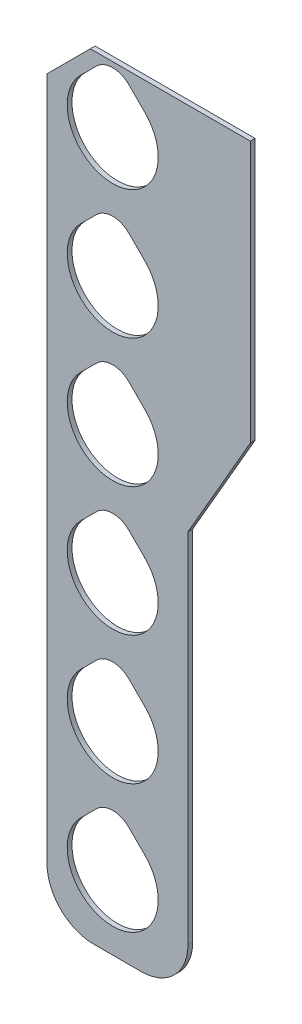
from build123d import *

# Parameters (mm, degrees)
EXTRUDE_1_DEPTH = 1


with BuildPart() as part:
    # 草图1 → 凸台-拉伸1 (new body)
    with BuildSketch(Plane.XY):
        with BuildLine():
            Line((15.8, 70.053589838), (28.876696831, 92.703093144))
            Line((28.876696831, 92.703093144), (28.876696831, 147.603847577))
            Line((28.876696831, 147.603847577), (-4.69377267, 147.603847577))
            Line((-4.69377267, 147.603847577), (-13.8, 138.497620247))
            Line((-13.8, 138.497620247), (-13.8, -5))
            ThreePointArc((-13.8, -5), (-10.929646456, -11.929646456), (-4, -14.8))
            Line((-4, -14.8), (6, -14.8))
            ThreePointArc((6, -14.8), (12.929646456, -11.929646456), (15.8, -5))
            Line((15.8, -5), (15.8, 70.053589838))
        make_face()
        with BuildLine():
            Line((-6.75286976, 6.75286976), (-3.411790219, 10.093949301))
            ThreePointArc((-3.411790219, 10.093949301), (0, 11.507159082), (3.411790219, 10.093949301))
            Line((3.411790219, 10.093949301), (6.75286976, 6.75286976))
            ThreePointArc((6.75286976, 6.75286976), (0, -9.55), (-6.75286976, 6.75286976))
        make_face(mode=Mode.SUBTRACT)
        with BuildLine():
            Line((3.411790219, 37.093949301), (6.75286976, 33.75286976))
            ThreePointArc((6.75286976, 33.75286976), (0, 17.45), (-6.75286976, 33.75286976))
            Line((-6.75286976, 33.75286976), (-3.411790219, 37.093949301))
            ThreePointArc((-3.411790219, 37.093949301), (0, 38.507159082), (3.411790219, 37.093949301))
        make_face(mode=Mode.SUBTRACT)
        with BuildLine():
            Line((3.411790219, 64.093949301), (6.75286976, 60.75286976))
            ThreePointArc((6.75286976, 60.75286976), (0, 44.45), (-6.75286976, 60.75286976))
            Line((-6.75286976, 60.75286976), (-3.411790219, 64.093949301))
            ThreePointArc((-3.411790219, 64.093949301), (0, 65.507159082), (3.411790219, 64.093949301))
        make_face(mode=Mode.SUBTRACT)
        with BuildLine():
            Line((-6.75286976, 87.75286976), (-3.411790219, 91.093949301))
            ThreePointArc((-3.411790219, 91.093949301), (0, 92.507159082), (3.411790219, 91.093949301))
            Line((3.411790219, 91.093949301), (6.75286976, 87.75286976))
            ThreePointArc((6.75286976, 87.75286976), (0, 71.45), (-6.75286976, 87.75286976))
        make_face(mode=Mode.SUBTRACT)
        with BuildLine():
            Line((-6.75286976, 114.75286976), (-3.411790219, 118.093949301))
            ThreePointArc((-3.411790219, 118.093949301), (0, 119.507159082), (3.411790219, 118.093949301))
            Line((3.411790219, 118.093949301), (6.75286976, 114.75286976))
            ThreePointArc((6.75286976, 114.75286976), (0, 98.45), (-6.75286976, 114.75286976))
        make_face(mode=Mode.SUBTRACT)
        with BuildLine():
            Line((3.411790219, 145.093949301), (6.75286976, 141.75286976))
            ThreePointArc((6.75286976, 141.75286976), (0, 125.45), (-6.75286976, 141.75286976))
            Line((-6.75286976, 141.75286976), (-3.411790219, 145.093949301))
            ThreePointArc((-3.411790219, 145.093949301), (0, 146.507159082), (3.411790219, 145.093949301))
        make_face(mode=Mode.SUBTRACT)
    extrude(amount=EXTRUDE_1_DEPTH)


solid = part.part
